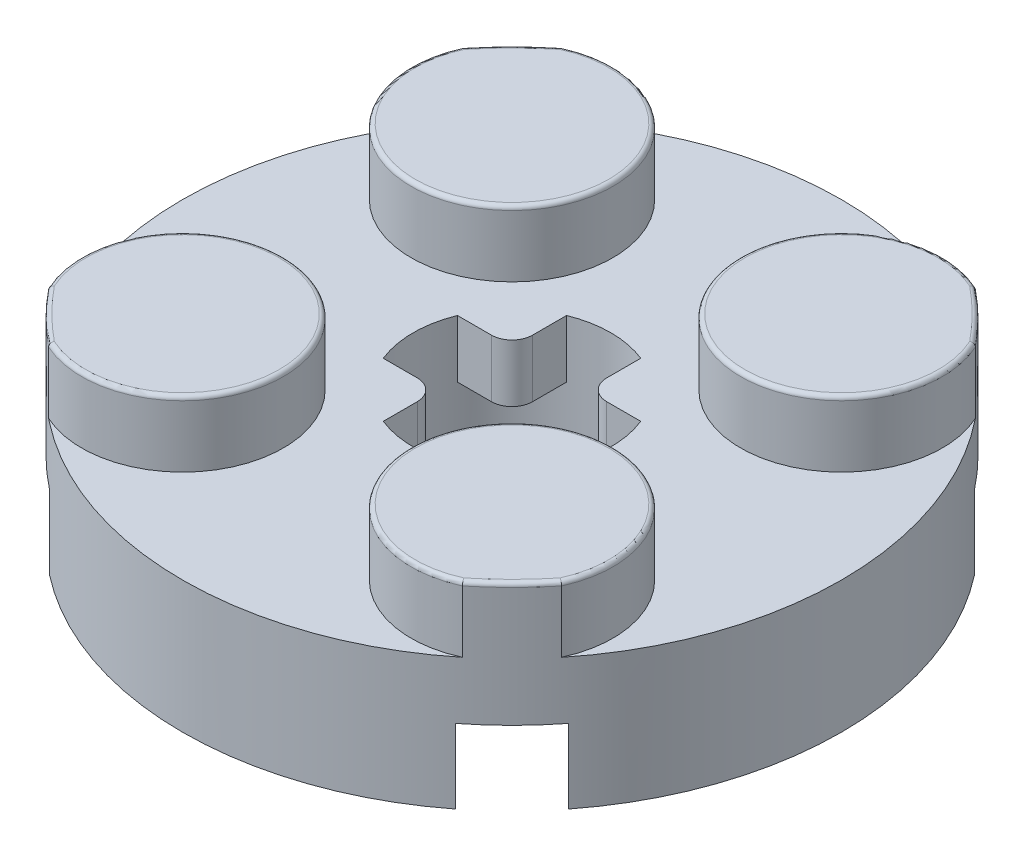
from build123d import *
from build123d.topology import SkipClean

# Parameters (mm, degrees)
CROQUIS1_W              = 8
CROQUIS1_H              = 8
SALIENTE_EXTRUIR1_DEPTH = 3.2
CROQUIS2_R              = 2.45
SALIENTE_EXTRUIR2_DEPTH = 1.6
CROQUIS3_W              = 12.6
CROQUIS3_H              = 12.6
CORTAR_EXTRUIR1_DEPTH   = 1.8
SALIENTE_EXTRUIR3_REACH = 19.636
CROQUIS5_R              = 3.267
CROQUIS5_R_2            = 2.4
CROQUIS6_OUTSIDE_W      = 22.626
CROQUIS6_OUTSIDE_H      = 22.626
CROQUIS6_OUTSIDE_R      = 8
CORTAR_EXTRUIR3_DEPTH   = 10
CORTAR_EXTRUIR4_DEPTH   = 18.269626516
CROQUIS6_3_R            = 9
CROQUIS6_3_R_2          = 8
CUT_EXTRUDE_THIN1_DEPTH = 18.269626516
REDONDEO4_R             = 0.1


with BuildPart() as part:
    # Croquis1 → Saliente-Extruir1 (new body)
    with BuildSketch(Plane(origin=(0, 0, 0), x_dir=(1, 0, 0), z_dir=(0, 1, 0))):
        Rectangle(CROQUIS1_W, CROQUIS1_H)
    saliente_extruir1 = extrude(amount=SALIENTE_EXTRUIR1_DEPTH)

    # Croquis2 → Saliente-Extruir2 (add)
    with BuildSketch(Plane(origin=(0, 3.2, 0), x_dir=(1, 0, 0), z_dir=(0, 1, 0))):
        Circle(CROQUIS2_R)
    saliente_extruir2 = extrude(amount=SALIENTE_EXTRUIR2_DEPTH)

    # Simetría1: Saliente-Extruir1, Saliente-Extruir2 across plane
    add(saliente_extruir1.mirror(Plane(origin=(4, 3.2, -4), x_dir=(0, 0, 1), z_dir=(-1, 0, 0))))
    add(saliente_extruir2.mirror(Plane(origin=(4, 3.2, -4), x_dir=(0, 0, 1), z_dir=(-1, 0, 0))))

    # Simetría2: part across plane


with BuildPart() as part_1:
    add(part.part)
    add(part.part.mirror(Plane(origin=(-4, 3.2, -4), x_dir=(1, 0, 0), z_dir=(0, 0, 1))))

    # Croquis3 → Cortar-Extruir1 (cut)
    with BuildSketch(Plane.XZ):
        with Locations((4, -4)):
            Rectangle(CROQUIS3_W, CROQUIS3_H)
    extrude(amount=-CORTAR_EXTRUIR1_DEPTH, mode=Mode.SUBTRACT)

    # Croquis5 → Saliente-Extruir3 (add, up to next)
    with BuildSketch(Plane.XZ, mode=Mode.PRIVATE) as saliente_extruir3_sk1:
        with Locations((4, -4)):
            Circle(CROQUIS5_R)
        with Locations((4, -4)):
            Circle(CROQUIS5_R_2, mode=Mode.SUBTRACT)
    saliente_extruir3_tool1 = extrude(saliente_extruir3_sk1.sketch, amount=-SALIENTE_EXTRUIR3_REACH, mode=Mode.PRIVATE) - part_1.part
    add(saliente_extruir3_tool1.solids().sort_by_distance((0.825405, 0, -4))[0])

    # Croquis6 outside → Cortar-Extruir3 (cut)
    with BuildSketch(Plane(origin=(0, 3.2, 0), x_dir=(1, 0, 0), z_dir=(0, 1, 0))):
        with Locations((4, 4)):
            Rectangle(CROQUIS6_OUTSIDE_W, CROQUIS6_OUTSIDE_H)
        with Locations((4, 4)):
            Circle(CROQUIS6_OUTSIDE_R, mode=Mode.SUBTRACT)
    extrude(amount=-CORTAR_EXTRUIR3_DEPTH, mode=Mode.SUBTRACT)

    # Croquis7 → Cortar-Extruir4 (cut, through all)
    with SkipClean():  # the faces are left unmerged after this step: merging them gives an invalid solid
        with BuildSketch(Plane(origin=(0, 3.2, 0), x_dir=(1, 0, 0), z_dir=(0, 1, 0))):
            with BuildLine():
                Line((2.6, 4.9), (1.775140454, 4.9))
                ThreePointArc((1.775140454, 4.9), (1.6, 4), (1.775140454, 3.1))
                Line((1.775140454, 3.1), (2.6, 3.1))
                ThreePointArc((2.6, 3.1), (2.953553391, 2.953553391), (3.1, 2.6))
                Line((3.1, 2.6), (3.1, 1.775140454))
                ThreePointArc((3.1, 1.775140454), (4, 1.6), (4.9, 1.775140454))
                Line((4.9, 1.775140454), (4.9, 2.6))
                ThreePointArc((4.9, 2.6), (5.046446609, 2.953553391), (5.4, 3.1))
                Line((5.4, 3.1), (6.224859546, 3.1))
                ThreePointArc((6.224859546, 3.1), (6.4, 4), (6.224859546, 4.9))
                Line((6.224859546, 4.9), (5.4, 4.9))
                ThreePointArc((5.4, 4.9), (5.046446609, 5.046446609), (4.9, 5.4))
                Line((4.9, 5.4), (4.9, 6.224859546))
                ThreePointArc((4.9, 6.224859546), (4, 6.4), (3.1, 6.224859546))
                Line((3.1, 6.224859546), (3.1, 5.4))
                ThreePointArc((3.1, 5.4), (2.953553391, 5.046446609), (2.6, 4.9))
            make_face()
        extrude(amount=-CORTAR_EXTRUIR4_DEPTH, mode=Mode.SUBTRACT)
    add(part_1.part.scale(1), mode=Mode.REPLACE)  # the faces are merged on a copy

    # Croquis6<3> → Cut-Extrude-Thin1 (cut, through all)
    with BuildSketch(Plane(origin=(0, 3.2, 0), x_dir=(1, 0, 0), z_dir=(0, 1, 0))):
        with Locations((4, 4)):
            Circle(CROQUIS6_3_R)
        with Locations((4, 4)):
            Circle(CROQUIS6_3_R_2, mode=Mode.SUBTRACT)
    extrude(amount=CUT_EXTRUDE_THIN1_DEPTH, mode=Mode.SUBTRACT)

    # Redondeo4
    redondeo4_edges = [part_1.edges().sort_by_distance(p)[0] for p in [
        (6.267588386, 4.8, -1.732411614),
        (1.732411614, 4.8, -1.732411614),
        (6.267588386, 4.8, -6.267588386),
        (1.732411614, 4.8, -6.267588386),
        (9.656854249, 4.8, 1.656854249),
        (-1.656854249, 4.8, 1.656854249),
        (9.656854249, 4.8, -9.656854249),
        (-1.656854249, 4.8, -9.656854249),
    ]]
    fillet(redondeo4_edges, radius=REDONDEO4_R)


solid = part_1.part
